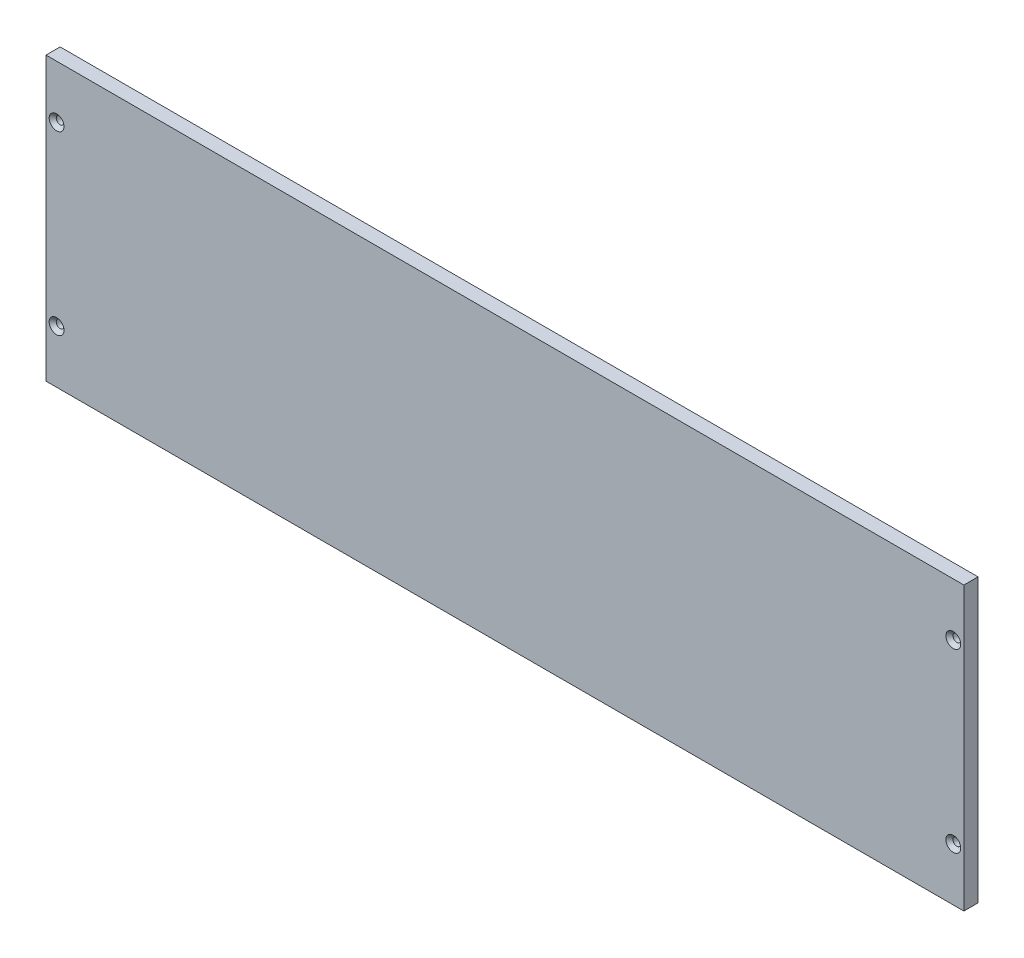
from build123d import *

# Parameters (mm, degrees)
ESQUISSE1_W             = 650
ESQUISSE1_H             = 200
BOSS_EXTRU_1_DEPTH      = 10
ESQUISSE2_R             = 2.75
ENL_V_MAT_EXTRU_1_DEPTH = 10
CHANFREIN1_SIZE         = 2.5


with BuildPart() as part:
    # Esquisse1 → Boss.-Extru.1 (new body)
    with BuildSketch(Plane.XY):
        with Locations((325, 100)):
            Rectangle(ESQUISSE1_W, ESQUISSE1_H)
    extrude(amount=BOSS_EXTRU_1_DEPTH)

    # Esquisse2 → Enlèv. mat.-Extru.1 (cut)
    with BuildSketch(Plane.XY.offset(10)):
        with Locations((7.5, 162.5)):
            Circle(ESQUISSE2_R)
        with Locations((642.5, 162.5)):
            Circle(ESQUISSE2_R)
        with Locations((7.5, 37.5)):
            Circle(ESQUISSE2_R)
        with Locations((642.5, 37.5)):
            Circle(ESQUISSE2_R)
    extrude(amount=-ENL_V_MAT_EXTRU_1_DEPTH, mode=Mode.SUBTRACT)

    # Chanfrein1
    chanfrein1_edges = [part.edges().sort_by_distance(p)[0] for p in [
        (4.75, 162.5, 10),
        (4.75, 37.5, 10),
        (639.75, 37.5, 10),
        (639.75, 162.5, 10),
    ]]
    chamfer(chanfrein1_edges, length=CHANFREIN1_SIZE)


solid = part.part
